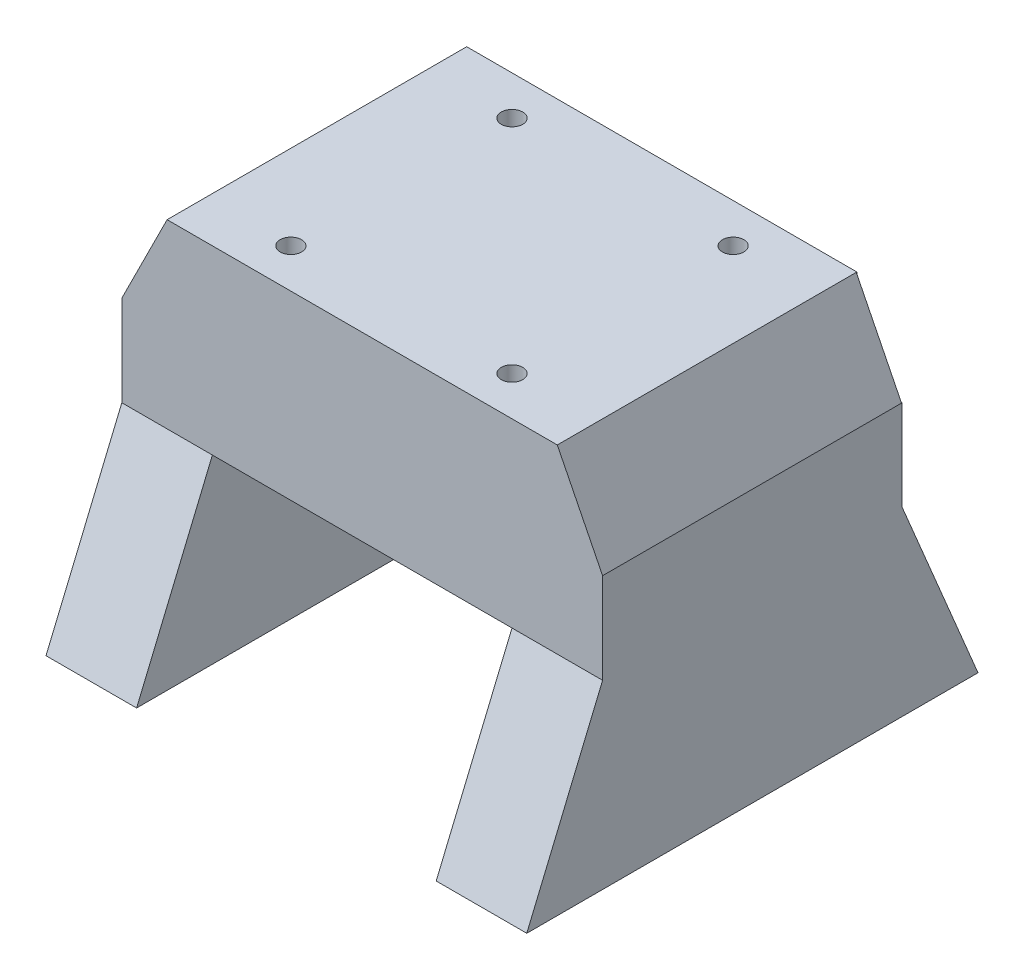
from build123d import *

# Parameters (mm, degrees)
SKETCH1_W           = 54.700000074
SKETCH1_H           = 42
SKETCH1_R           = 1.5
BOSS_EXTRUDE1_DEPTH = 25.4
BOSS_EXTRUDE4_DEPTH = 6.35
BOSS_EXTRUDE5_START = -54.700000074
BOSS_EXTRUDE5_DEPTH = 6.35
BOSS_EXTRUDE6_DEPTH = 41.91


with BuildPart() as part:
    # Sketch1 → Boss-Extrude1 (new body)
    with BuildSketch(Plane(origin=(0, 0, 0), x_dir=(1, 0, 0), z_dir=(0, 1, 0))):
        Rectangle(SKETCH1_W, SKETCH1_H)
        with Locations((-15.5, 15.5)):
            Circle(SKETCH1_R, mode=Mode.SUBTRACT)
        with Locations((15.5, 15.5)):
            Circle(SKETCH1_R, mode=Mode.SUBTRACT)
        with Locations((15.5, -15.5)):
            Circle(SKETCH1_R, mode=Mode.SUBTRACT)
        with Locations((-15.5, -15.5)):
            Circle(SKETCH1_R, mode=Mode.SUBTRACT)
    extrude(amount=BOSS_EXTRUDE1_DEPTH)

    # Sketch3 → Boss-Extrude4 (add, symmetric)
    with BuildSketch(Plane(origin=(27.350000037, 0, 0), x_dir=(0, 0, -1), z_dir=(1, 0, 0))):
        Polygon((-21, 12.7), (-21, 0), (-31.628244686, -25.4), (31.628244686, -25.4), (21, 0), (21, 12.7), align=None)
    extrude(amount=BOSS_EXTRUDE4_DEPTH, both=True)

    # Sketch3<3> → Boss-Extrude5 (add, symmetric)
    with BuildSketch(Plane(origin=(27.350000037, 0, 0), x_dir=(0, 0, -1), z_dir=(1, 0, 0)).offset(BOSS_EXTRUDE5_START)):
        Polygon((-21, 12.7), (-21, 0), (-31.628244686, -25.4), (31.628244686, -25.4), (21, 0), (21, 12.7), align=None)
    extrude(amount=BOSS_EXTRUDE5_DEPTH, both=True)

    # Sketch4 → Boss-Extrude6 (add)
    with BuildSketch(Plane.XY.offset(21)):
        Polygon((-33.700000037, 12.7), (-27.350000037, 12.7), (-27.350000037, 25.4), align=None)
        Polygon((33.700000037, 12.7), (27.350000037, 25.4), (27.350000037, 12.7), align=None)
    extrude(amount=-BOSS_EXTRUDE6_DEPTH)


solid = part.part
